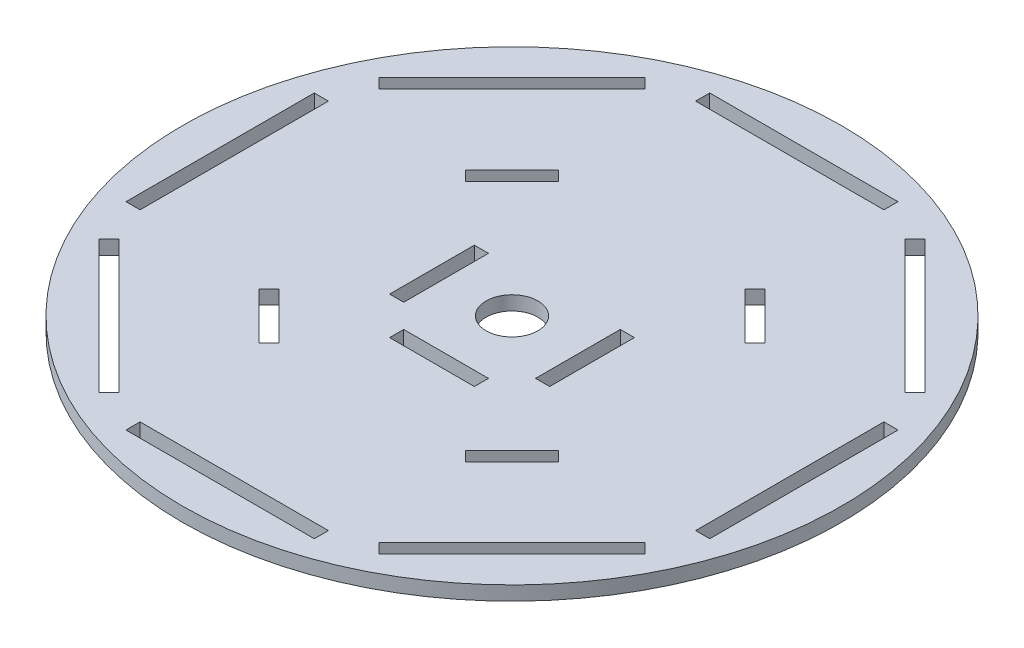
from build123d import *

# Parameters (mm, degrees)
CROQUIS1_R              = 70
CROQUIS1_R_2            = 5.5
SALIENTE_EXTRUIR1_DEPTH = 3


with BuildPart() as part:
    # Croquis1 → Saliente-Extruir1 (new body)
    with BuildSketch(Plane(origin=(0, 0, 0), x_dir=(1, 0, 0), z_dir=(0, 1, 0))):
        Circle(CROQUIS1_R)
        Circle(CROQUIS1_R_2, mode=Mode.SUBTRACT)
        Polygon((24.748737342, 24.748737342), (29.69848481, 19.798989873), (31.819805153, 21.920310217), (21.920310217, 31.819805153), (19.798989873, 29.69848481), align=None, mode=Mode.SUBTRACT)
        Polygon((24.748737342, -24.748737342), (19.798989873, -29.69848481), (21.920310217, -31.819805153), (31.819805153, -21.920310217), (29.69848481, -19.798989873), align=None, mode=Mode.SUBTRACT)
        Polygon((-24.748737342, 24.748737342), (-19.798989873, 29.69848481), (-21.920310217, 31.819805153), (-31.819805153, 21.920310217), (-29.69848481, 19.798989873), align=None, mode=Mode.SUBTRACT)
        Polygon((-24.748737342, -24.748737342), (-29.69848481, -19.798989873), (-31.819805153, -21.920310217), (-21.920310217, -31.819805153), (-19.798989873, -29.69848481), align=None, mode=Mode.SUBTRACT)
        Polygon((-14, 0), (-14, 9), (-17, 9), (-17, -9), (-14, -9), align=None, mode=Mode.SUBTRACT)
        Polygon((14, 0), (14, -9), (17, -9), (17, 9), (14, 9), align=None, mode=Mode.SUBTRACT)
        Polygon((0, -14), (-9, -14), (-9, -17), (9, -17), (9, -14), align=None, mode=Mode.SUBTRACT)
        Polygon((0, 62), (20, 62), (20, 59), (-20, 59), (-20, 62), align=None, mode=Mode.SUBTRACT)
        Polygon((55.861435714, 27.577164466), (27.577164466, 55.861435714), (29.69848481, 57.982756057), (43.840620434, 43.840620434), (57.982756057, 29.69848481), align=None, mode=Mode.SUBTRACT)
        Polygon((59, -20), (59, 20), (62, 20), (62, 0), (62, -20), align=None, mode=Mode.SUBTRACT)
        Polygon((27.577164466, -55.861435714), (55.861435714, -27.577164466), (57.982756057, -29.69848481), (43.840620434, -43.840620434), (29.69848481, -57.982756057), align=None, mode=Mode.SUBTRACT)
        Polygon((-20, -59), (20, -59), (20, -62), (0, -62), (-20, -62), align=None, mode=Mode.SUBTRACT)
        Polygon((-55.861435714, -27.577164466), (-27.577164466, -55.861435714), (-29.69848481, -57.982756057), (-43.840620434, -43.840620434), (-57.982756057, -29.69848481), align=None, mode=Mode.SUBTRACT)
        Polygon((-59, 20), (-59, -20), (-62, -20), (-62, 0), (-62, 20), align=None, mode=Mode.SUBTRACT)
        Polygon((-27.577164466, 55.861435714), (-55.861435714, 27.577164466), (-57.982756057, 29.69848481), (-43.840620434, 43.840620434), (-29.69848481, 57.982756057), align=None, mode=Mode.SUBTRACT)
    extrude(amount=SALIENTE_EXTRUIR1_DEPTH)


solid = part.part
